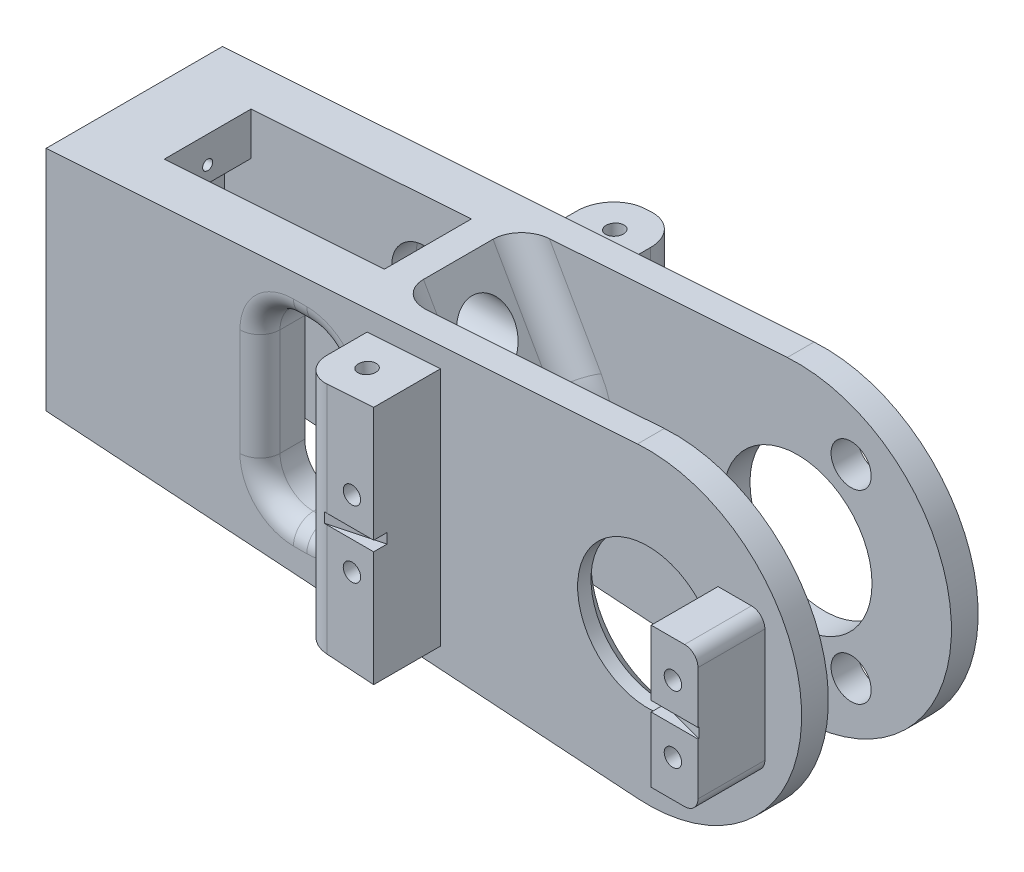
from build123d import *

# Parameters (mm, degrees)
BOSS_EXTRUDE2_DEPTH      = 23.2
BOSS_EXTRUDE2_DEPTH_BACK = 13.2
CUT_EXTRUDE1_DEPTH       = 9.2
CUT_EXTRUDE2_REACH       = 101.77
SKETCH6_R                = 11.125
CUT_EXTRUDE3_REACH       = 97.555
SKETCH7_R                = 10.5
SKETCH8_W                = 41.5
SKETCH8_H                = 21
CUT_EXTRUDE4_DEPTH       = 10
SKETCH9_R                = 1.3
CUT_EXTRUDE5_DEPTH       = 10
CUT_EXTRUDE7_DEPTH       = 0.75
FILLET1_R                = 4
CUT_EXTRUDE8_DEPTH       = 6.5
CUT_EXTRUDE9_REACH       = 119.628
SKETCH13_R               = 0.75
CUT_EXTRUDE10_DEPTH      = 1.5
CUT_EXTRUDE12_REACH      = 97.746
SKETCH20_R               = 4
CUT_EXTRUDE13_START      = -10
SKETCH21_W               = 7
SKETCH21_H               = 21
CUT_EXTRUDE13_DEPTH      = 10
SKETCH22_W               = 12
SKETCH22_H               = 26
CUT_EXTRUDE14_DEPTH      = 97.571013658
FILLET2_R                = 5
FILLET3_R                = 3
BOSS_EXTRUDE3_DEPTH      = 10
SKETCH24_R               = 1.3
CUT_EXTRUDE15_DEPTH      = 102.210689607
FILLET4_R                = 4
FILLET5_R                = 2
FILLET6_R                = 5
CHAMFER1_SIZE            = 2
CUT_EXTRUDE16_REACH      = 101.77
SKETCH25_R               = 3
SKETCH26_R               = 11
CUT_EXTRUDE17_DEPTH      = 2
CUT_EXTRUDE18_DEPTH      = 98.963302489
CUT_EXTRUDE18_DEPTH_BACK = 98.963302489
SKETCH28_R               = 1.3


with BuildPart() as part:
    # Sketch1 → Boss-Extrude2 (new, two sides: drawn at the far end of the back side and taken through both)
    with BuildSketch(Plane.XY.offset(-BOSS_EXTRUDE2_DEPTH_BACK)):
        with BuildLine():
            Line((-90.000003772, 16.999225933), (-1.54332219, 22.94816238))
            ThreePointArc((-1.54332219, 22.94816238), (22.999999999, 0.000154116), (-1.543014653, -22.948183061))
            Line((-1.543014653, -22.948183061), (-90.000003772, -17.000416738))
            Line((-90.000003772, -17.000416738), (-90.000003772, 16.999225933))
        make_face()
    extrude(amount=BOSS_EXTRUDE2_DEPTH + BOSS_EXTRUDE2_DEPTH_BACK)

    # Sketch5 → Cut-Extrude1 (cut, symmetric)
    with BuildSketch(Plane.XY):
        with BuildLine():
            Line((-41.55, 20.257611712), (-1.54332219, 22.94816238))
            ThreePointArc((-1.54332219, 22.94816238), (22.999999999, 0.000154116), (-1.543014653, -22.948183061))
            Line((-1.543014653, -22.948183061), (-41.55, -20.258150283))
            Line((-41.55, -20.258150283), (-32.853088867, -4.93659019))
            ThreePointArc((-32.853088867, -4.93659019), (-31.549690707, 7.5457e-05), (-32.853163366, 4.936721435))
            Line((-32.853163366, 4.936721435), (-41.55, 20.257611712))
        make_face()
    extrude(amount=CUT_EXTRUDE1_DEPTH, both=True, mode=Mode.SUBTRACT)

    # Sketch6 → Cut-Extrude2 (cut, up to next)
    with BuildSketch(Plane(origin=(0, 0, -13.2), x_dir=(-1, 0, 0), z_dir=(0, 0, -1)), mode=Mode.PRIVATE) as cut_extrude2_sk1:
        Circle(SKETCH6_R)
    cut_extrude2_tool1 = extrude(cut_extrude2_sk1.sketch, amount=-CUT_EXTRUDE2_REACH, mode=Mode.PRIVATE) & part.part
    add(cut_extrude2_tool1.solids().sort_by_distance((0, 0, -13.2))[0], mode=Mode.SUBTRACT)

    # Sketch7 → Cut-Extrude3 (cut, up to next)
    with BuildSketch(Plane(origin=(0, 0, 9.2), x_dir=(-1, 0, 0), z_dir=(0, 0, -1)), mode=Mode.PRIVATE) as cut_extrude3_sk1:
        Circle(SKETCH7_R)
    cut_extrude3_tool1 = extrude(cut_extrude3_sk1.sketch, amount=-CUT_EXTRUDE3_REACH, mode=Mode.PRIVATE) & part.part
    add(cut_extrude3_tool1.solids().sort_by_distance((0, 0, 9.2))[0], mode=Mode.SUBTRACT)

    # Sketch8 → Cut-Extrude4 (cut)
    with BuildSketch(Plane.XY.offset(23.2)):
        with Locations((-10.25, 0)):
            Rectangle(SKETCH8_W, SKETCH8_H)
    extrude(amount=-CUT_EXTRUDE4_DEPTH, mode=Mode.SUBTRACT)

    # Sketch9 → Cut-Extrude5 (cut)
    with BuildSketch(Plane.XY.offset(23.2)):
        with Locations((13.75, 5)):
            Circle(SKETCH9_R)
        with Locations((-34.25, 5)):
            Circle(SKETCH9_R)
        with Locations(Location((13.75, -5, 0), (0, 0, 180))):
            Circle(SKETCH9_R)
        with Locations(Location((-34.25, -5, 0), (0, 0, 180))):
            Circle(SKETCH9_R)
    extrude(amount=-CUT_EXTRUDE5_DEPTH, mode=Mode.SUBTRACT)

    # Sketch10 → Cut-Extrude7 (cut, symmetric)
    with BuildSketch(Plane(origin=(0, 0, 0), x_dir=(1, 0, 0), z_dir=(0, 1, 0))):
        Polygon((-31, -23.2), (-38.496594202, -23.2), (-31, -21.2), align=None)
        Polygon((10.5, -23.2), (18, -23.2), (10.5, -21.2), align=None)
    extrude(amount=CUT_EXTRUDE7_DEPTH, both=True, mode=Mode.SUBTRACT)

    # Fillet1
    fillet1_edges = [part.edges().sort_by_distance(p)[0] for p in [
        (-37.201544434, -12.597370237, -9.2),
        (-31.549690707, 7.5457e-05, -9.2),
        (-37.201581683, 12.597166573, -9.2),
        (-37.201581683, 12.597166573, 9.2),
        (-31.549690707, 7.5457e-05, 9.2),
        (-37.201544434, -12.597370237, 9.2),
    ]]
    fillet(fillet1_edges, radius=FILLET1_R)

    # Sketch11 → Cut-Extrude8 (cut, symmetric)
    with BuildSketch(Plane.XY):
        Polygon((-46.099171392, 19.951668384), (-46.09914172, -19.952270192), (-79.024795677, -17.738379603), (-79.024795677, -11.662663454), (-83.024795677, -11.662663454), (-83.024795677, 11.337336546), (-79.024795677, 11.337336546), (-79.024795677, 17.737336546), align=None)
    extrude(amount=CUT_EXTRUDE8_DEPTH, both=True, mode=Mode.SUBTRACT)

    # Sketch12 → Cut-Extrude9 (cut, up to next)
    with BuildSketch(Plane.ZY.offset(90.000003772), mode=Mode.PRIVATE) as cut_extrude9_sk1:
        with BuildLine():
            ThreePointArc((2.892539024, -0.579411765), (0, 2.95), (-2.892539024, -0.579411765))
            ThreePointArc((-2.892539024, -0.579411765), (0, -12.05), (2.892539024, -0.579411765))
        make_face()
    cut_extrude9_tool1 = extrude(cut_extrude9_sk1.sketch, amount=-CUT_EXTRUDE9_REACH, mode=Mode.PRIVATE) & part.part
    add(cut_extrude9_tool1.solids().sort_by_distance((-90.000004, -5.17554, 0))[0], mode=Mode.SUBTRACT)

    # Sketch13 → Cut-Extrude10 (cut)
    with BuildSketch(Plane(origin=(-79.024795677, 0, 0), x_dir=(0, 0, -1), z_dir=(1, 0, 0))):
        with Locations((0, -14.05)):
            Circle(SKETCH13_R)
        with Locations((0, 13.75)):
            Circle(SKETCH13_R)
    extrude(amount=-CUT_EXTRUDE10_DEPTH, mode=Mode.SUBTRACT)

    # Sketch20 → Cut-Extrude12 (cut, up to next)
    with BuildSketch(Plane(origin=(0, 0, 0), x_dir=(0, 0, -1), z_dir=(1, 0, 0)), mode=Mode.PRIVATE) as cut_extrude12_sk1:
        with Locations(Location((0, 12.597166573, 0), (0, 0, 90))):
            Circle(SKETCH20_R)
    cut_extrude12_tool1 = extrude(cut_extrude12_sk1.sketch, amount=-CUT_EXTRUDE12_REACH, mode=Mode.PRIVATE) & part.part
    # Sketch20 → Cut-Extrude12 (cut, up to next)
    with BuildSketch(Plane(origin=(0, 0, 0), x_dir=(0, 0, -1), z_dir=(1, 0, 0)), mode=Mode.PRIVATE) as cut_extrude12_sk2:
        with Locations(Location((0, -12.596982832, 0), (0, 0, 90))):
            Circle(SKETCH20_R)
    cut_extrude12_tool2 = extrude(cut_extrude12_sk2.sketch, amount=-CUT_EXTRUDE12_REACH, mode=Mode.PRIVATE) & part.part
    add(cut_extrude12_tool1.solids().sort_by_distance((0, 12.597167, 0))[0], mode=Mode.SUBTRACT)
    add(cut_extrude12_tool2.solids().sort_by_distance((0, -12.596983, 0))[0], mode=Mode.SUBTRACT)

    # Sketch21 → Cut-Extrude13 (cut)
    with BuildSketch(Plane.XY.offset(23.2).offset(CUT_EXTRUDE13_START)):
        with BuildLine():
            Line((-90.000003772, 16.999225933), (-90.000003772, -17.000416738))
            Line((-90.000003772, -17.000416738), (-1.543014653, -22.948183061))
            ThreePointArc((-1.543014653, -22.948183061), (22.999999999, 0.000154116), (-1.54332219, 22.94816238))
            Line((-1.54332219, 22.94816238), (-90.000003772, 16.999225933))
        make_face()
        Polygon((-31, -17.960748556), (-31, 17.960349298), (-41.975208095, 17.222238686), (-41.975208095, -17.222785691), align=None, mode=Mode.SUBTRACT)
        with Locations((14, 0)):
            Rectangle(SKETCH21_W, SKETCH21_H, mode=Mode.SUBTRACT)
    extrude(amount=CUT_EXTRUDE13_DEPTH, mode=Mode.SUBTRACT)

    # Sketch22 → Cut-Extrude14 (cut, through all)
    with BuildSketch(Plane.XY.offset(13.2)):
        with Locations((-52, 0)):
            Rectangle(SKETCH22_W, SKETCH22_H)
    extrude(amount=-CUT_EXTRUDE14_DEPTH, mode=Mode.SUBTRACT)

    # Fillet2
    # the kernel refuses this fillet: 5 mm, written as the material it adds along each edge
    with BuildSketch(Plane(origin=(-58, -13, -6.5), x_dir=(1, 0, 0), z_dir=(0, 0, -1)), Plane(origin=(-58, 13, -6.5), x_dir=(0, -1, 0), z_dir=(0, 0, -1)), Plane(origin=(-58, -13, 13.2), x_dir=(1, 0, 0), z_dir=(0, 0, -1))) as fillet2_piece_1:
        with BuildLine():
            CenterArc((FILLET2_R, -FILLET2_R), FILLET2_R, 90, 90)
            Line((0, -FILLET2_R), (0, 0))
            Line((0, 0), (FILLET2_R, 0))
        make_face()
    extrude(amount=6.7)
    with BuildSketch(Plane(origin=(-46, -13, 8.520354644), x_dir=(-1, 0, 0), z_dir=(0, 0, -1))) as fillet2_piece_2_section:
        with BuildLine():
            CenterArc((FILLET2_R, FILLET2_R), FILLET2_R, 180, 90)
            Line((0, FILLET2_R), (0, 0))
            Line((0, 0), (FILLET2_R, 0))
        make_face()
    fillet2_piece_2 = extrude(amount=21.720354644, mode=Mode.PRIVATE)
    fillet2_piece_2 = split(fillet2_piece_2, bisect_by=Plane(origin=(-47.331007708, -12.072495105, 6.5), z_dir=(0, 0, 1)), keep=Keep.TOP, mode=Mode.PRIVATE)
    fillet2_piece_2 = split(fillet2_piece_2, bisect_by=Plane(origin=(-46.09914758, -12.072494189, 7.510177322), z_dir=(-0.9999999999997237, -7.435896198998702e-07, 0)), keep=Keep.TOP, mode=Mode.PRIVATE)
    add(fillet2_piece_2)
    with BuildSketch(Plane(origin=(-46, -13, 8.520354644), x_dir=(-1, 0, 0), z_dir=(0, 0, -1))) as fillet2_piece_3_section:
        with BuildLine():
            CenterArc((FILLET2_R, FILLET2_R), FILLET2_R, 180, 90)
            Line((0, FILLET2_R), (0, 0))
            Line((0, 0), (FILLET2_R, 0))
        make_face()
    fillet2_piece_3 = extrude(amount=21.720354644, mode=Mode.PRIVATE)
    fillet2_piece_3 = split(fillet2_piece_3, bisect_by=Plane(origin=(-45.995438086, -10.700431133, 6.5), z_dir=(0, 0, 1)), keep=Keep.TOP, mode=Mode.PRIVATE)
    fillet2_piece_3 = split(fillet2_piece_3, bisect_by=Plane(origin=(-46.0991486, -10.70043121, 7.510177322), z_dir=(0.9999999999997237, 7.435896198998702e-07, 0)), keep=Keep.TOP, mode=Mode.PRIVATE)
    add(fillet2_piece_3)
    with BuildSketch(Plane(origin=(-46, -13, 8.520354644), x_dir=(-1, 0, 0), z_dir=(0, 0, -1))) as fillet2_piece_4_section:
        with BuildLine():
            CenterArc((FILLET2_R, FILLET2_R), FILLET2_R, 180, 90)
            Line((0, FILLET2_R), (0, 0))
            Line((0, 0), (FILLET2_R, 0))
        make_face()
    fillet2_piece_4 = extrude(amount=21.720354644, mode=Mode.PRIVATE)
    fillet2_piece_4 = split(fillet2_piece_4, bisect_by=Plane(origin=(-46.006211132, -8.49973528, 6.5), z_dir=(0, 0, -1)), keep=Keep.TOP, mode=Mode.PRIVATE)
    fillet2_piece_4 = split(fillet2_piece_4, bisect_by=Plane(origin=(-46.099150236, -8.499735349, 0), z_dir=(0.9999999999997237, 7.435896198998702e-07, 0)), keep=Keep.TOP, mode=Mode.PRIVATE)
    fillet2_piece_4 = split(fillet2_piece_4, bisect_by=Plane(origin=(-46.006211132, -8.49973528, -6.5), z_dir=(0, 0, 1)), keep=Keep.TOP, mode=Mode.PRIVATE)
    fillet2_piece_4 = fillet2_piece_4 - Plane(origin=(-46.006211132, -12.596982832, 0), x_dir=(0, 1, 0), z_dir=(1, 0, 0)) * Cylinder(4, 64, mode=Mode.PRIVATE)
    add(fillet2_piece_4)
    with BuildSketch(Plane(origin=(-46, -13, 8.520354644), x_dir=(-1, 0, 0), z_dir=(0, 0, -1))) as fillet2_piece_5_section:
        with BuildLine():
            CenterArc((FILLET2_R, FILLET2_R), FILLET2_R, 180, 90)
            Line((0, FILLET2_R), (0, 0))
            Line((0, 0), (FILLET2_R, 0))
        make_face()
    fillet2_piece_5 = extrude(amount=21.720354644, mode=Mode.PRIVATE)
    fillet2_piece_5 = split(fillet2_piece_5, bisect_by=Plane(origin=(-46.0991486, -10.70043121, -9.85), z_dir=(0.9999999999997237, 7.435896198998702e-07, 0)), keep=Keep.TOP, mode=Mode.PRIVATE)
    fillet2_piece_5 = split(fillet2_piece_5, bisect_by=Plane(origin=(-45.995438086, -10.700431133, -6.5), z_dir=(0, 0, -1)), keep=Keep.TOP, mode=Mode.PRIVATE)
    add(fillet2_piece_5)
    with BuildSketch(Plane(origin=(-46, -13, 8.520354644), x_dir=(-1, 0, 0), z_dir=(0, 0, -1))) as fillet2_piece_6_section:
        with BuildLine():
            CenterArc((FILLET2_R, FILLET2_R), FILLET2_R, 180, 90)
            Line((0, FILLET2_R), (0, 0))
            Line((0, 0), (FILLET2_R, 0))
        make_face()
    fillet2_piece_6 = extrude(amount=21.720354644, mode=Mode.PRIVATE)
    fillet2_piece_6 = split(fillet2_piece_6, bisect_by=Plane(origin=(-46.09914758, -12.072494189, -9.85), z_dir=(-0.9999999999997237, -7.435896198998702e-07, 0)), keep=Keep.TOP, mode=Mode.PRIVATE)
    fillet2_piece_6 = split(fillet2_piece_6, bisect_by=Plane(origin=(-47.331007708, -12.072495105, -6.5), z_dir=(0, 0, -1)), keep=Keep.TOP, mode=Mode.PRIVATE)
    add(fillet2_piece_6)
    with BuildSketch(Plane(origin=(-46, -13, 13.2), x_dir=(0, 1, 0), z_dir=(0, 0, -1))) as fillet2_piece_7_section:
        with BuildLine():
            CenterArc((FILLET2_R, -FILLET2_R), FILLET2_R, 90, 90)
            Line((0, -FILLET2_R), (0, 0))
            Line((0, 0), (FILLET2_R, 0))
        make_face()
    fillet2_piece_7 = extrude(amount=21.720354644, mode=Mode.PRIVATE)
    fillet2_piece_7 = split(fillet2_piece_7, bisect_by=Plane(origin=(-45.995438086, -10.700431133, 6.5), z_dir=(0, 0, 1)), keep=Keep.TOP, mode=Mode.PRIVATE)
    fillet2_piece_7 = split(fillet2_piece_7, bisect_by=Plane(origin=(-46.0991486, -10.70043121, 9.85), z_dir=(0.9999999999997237, 7.435896198998702e-07, 0)), keep=Keep.TOP, mode=Mode.PRIVATE)
    add(fillet2_piece_7)
    with BuildSketch(Plane(origin=(-46, -13, 13.2), x_dir=(0, 1, 0), z_dir=(0, 0, -1))) as fillet2_piece_8_section:
        with BuildLine():
            CenterArc((FILLET2_R, -FILLET2_R), FILLET2_R, 90, 90)
            Line((0, -FILLET2_R), (0, 0))
            Line((0, 0), (FILLET2_R, 0))
        make_face()
    fillet2_piece_8 = extrude(amount=21.720354644, mode=Mode.PRIVATE)
    fillet2_piece_8 = split(fillet2_piece_8, bisect_by=Plane(origin=(-47.331007708, -12.072495105, 6.5), z_dir=(0, 0, 1)), keep=Keep.TOP, mode=Mode.PRIVATE)
    fillet2_piece_8 = split(fillet2_piece_8, bisect_by=Plane(origin=(-46.09914758, -12.072494189, 9.85), z_dir=(-0.9999999999997237, -7.435896198998702e-07, 0)), keep=Keep.TOP, mode=Mode.PRIVATE)
    add(fillet2_piece_8)
    with BuildSketch(Plane(origin=(-46, -13, 13.2), x_dir=(0, 1, 0), z_dir=(0, 0, -1))) as fillet2_piece_9_section:
        with BuildLine():
            CenterArc((FILLET2_R, -FILLET2_R), FILLET2_R, 90, 90)
            Line((0, -FILLET2_R), (0, 0))
            Line((0, 0), (FILLET2_R, 0))
        make_face()
    fillet2_piece_9 = extrude(amount=21.720354644, mode=Mode.PRIVATE)
    fillet2_piece_9 = split(fillet2_piece_9, bisect_by=Plane(origin=(-46.006211132, -8.49973528, 6.5), z_dir=(0, 0, -1)), keep=Keep.TOP, mode=Mode.PRIVATE)
    fillet2_piece_9 = split(fillet2_piece_9, bisect_by=Plane(origin=(-46.099150236, -8.499735349, 0), z_dir=(0.9999999999997237, 7.435896198998702e-07, 0)), keep=Keep.TOP, mode=Mode.PRIVATE)
    fillet2_piece_9 = split(fillet2_piece_9, bisect_by=Plane(origin=(-46.006211132, -8.49973528, -6.5), z_dir=(0, 0, 1)), keep=Keep.TOP, mode=Mode.PRIVATE)
    fillet2_piece_9 = fillet2_piece_9 - Plane(origin=(-46.006211132, -12.596982832, 0), x_dir=(0, 1, 0), z_dir=(1, 0, 0)) * Cylinder(4, 64, mode=Mode.PRIVATE)
    add(fillet2_piece_9)
    with BuildSketch(Plane(origin=(-46, -13, 13.2), x_dir=(0, 1, 0), z_dir=(0, 0, -1))) as fillet2_piece_10_section:
        with BuildLine():
            CenterArc((FILLET2_R, -FILLET2_R), FILLET2_R, 90, 90)
            Line((0, -FILLET2_R), (0, 0))
            Line((0, 0), (FILLET2_R, 0))
        make_face()
    fillet2_piece_10 = extrude(amount=21.720354644, mode=Mode.PRIVATE)
    fillet2_piece_10 = split(fillet2_piece_10, bisect_by=Plane(origin=(-46.0991486, -10.70043121, -7.510177322), z_dir=(0.9999999999997237, 7.435896198998702e-07, 0)), keep=Keep.TOP, mode=Mode.PRIVATE)
    fillet2_piece_10 = split(fillet2_piece_10, bisect_by=Plane(origin=(-45.995438086, -10.700431133, -6.5), z_dir=(0, 0, -1)), keep=Keep.TOP, mode=Mode.PRIVATE)
    add(fillet2_piece_10)
    with BuildSketch(Plane(origin=(-46, -13, 13.2), x_dir=(0, 1, 0), z_dir=(0, 0, -1))) as fillet2_piece_11_section:
        with BuildLine():
            CenterArc((FILLET2_R, -FILLET2_R), FILLET2_R, 90, 90)
            Line((0, -FILLET2_R), (0, 0))
            Line((0, 0), (FILLET2_R, 0))
        make_face()
    fillet2_piece_11 = extrude(amount=21.720354644, mode=Mode.PRIVATE)
    fillet2_piece_11 = split(fillet2_piece_11, bisect_by=Plane(origin=(-46.09914758, -12.072494189, -7.510177322), z_dir=(-0.9999999999997237, -7.435896198998702e-07, 0)), keep=Keep.TOP, mode=Mode.PRIVATE)
    fillet2_piece_11 = split(fillet2_piece_11, bisect_by=Plane(origin=(-47.331007708, -12.072495105, -6.5), z_dir=(0, 0, -1)), keep=Keep.TOP, mode=Mode.PRIVATE)
    add(fillet2_piece_11)
    with BuildSketch(Plane(origin=(-58, 13, 13.2), x_dir=(1, 0, 0), z_dir=(0, 0, -1))) as fillet2_piece_12:
        with BuildLine():
            CenterArc((FILLET2_R, FILLET2_R), FILLET2_R, 180, 90)
            Line((0, FILLET2_R), (0, 0))
            Line((0, 0), (FILLET2_R, 0))
        make_face()
    extrude(amount=6.7)
    with BuildSketch(Plane(origin=(-46, 13, 8.520336041), x_dir=(-1, 0, 0), z_dir=(0, 0, -1))) as fillet2_piece_13_section:
        with BuildLine():
            CenterArc((FILLET2_R, -FILLET2_R), FILLET2_R, 90, 90)
            Line((0, -FILLET2_R), (0, 0))
            Line((0, 0), (FILLET2_R, 0))
        make_face()
    fillet2_piece_13 = extrude(amount=21.720336041, mode=Mode.PRIVATE)
    fillet2_piece_13 = split(fillet2_piece_13, bisect_by=Plane(origin=(-47.331023035, 12.0725063, 6.5), z_dir=(0, 0, 1)), keep=Keep.TOP, mode=Mode.PRIVATE)
    fillet2_piece_13 = split(fillet2_piece_13, bisect_by=Plane(origin=(-46.099165534, 12.072507216, 7.51016802), z_dir=(-0.9999999999997237, -7.435896198998702e-07, 0)), keep=Keep.TOP, mode=Mode.PRIVATE)
    add(fillet2_piece_13)
    with BuildSketch(Plane(origin=(-46, 13, 8.520336041), x_dir=(-1, 0, 0), z_dir=(0, 0, -1))) as fillet2_piece_14_section:
        with BuildLine():
            CenterArc((FILLET2_R, -FILLET2_R), FILLET2_R, 90, 90)
            Line((0, -FILLET2_R), (0, 0))
            Line((0, 0), (FILLET2_R, 0))
        make_face()
    fillet2_piece_14 = extrude(amount=21.720336041, mode=Mode.PRIVATE)
    fillet2_piece_14 = split(fillet2_piece_14, bisect_by=Plane(origin=(-45.995445455, 10.700464693, 6.5), z_dir=(0, 0, 1)), keep=Keep.TOP, mode=Mode.PRIVATE)
    fillet2_piece_14 = split(fillet2_piece_14, bisect_by=Plane(origin=(-46.099164513, 10.700464615, 7.51016802), z_dir=(0.9999999999997237, 7.435896198998702e-07, 0)), keep=Keep.TOP, mode=Mode.PRIVATE)
    add(fillet2_piece_14)
    with BuildSketch(Plane(origin=(-46, 13, 8.520336041), x_dir=(-1, 0, 0), z_dir=(0, 0, -1))) as fillet2_piece_15_section:
        with BuildLine():
            CenterArc((FILLET2_R, -FILLET2_R), FILLET2_R, 90, 90)
            Line((0, -FILLET2_R), (0, 0))
            Line((0, 0), (FILLET2_R, 0))
        make_face()
    fillet2_piece_15 = extrude(amount=21.720336041, mode=Mode.PRIVATE)
    fillet2_piece_15 = split(fillet2_piece_15, bisect_by=Plane(origin=(-46.006213875, 8.499769048, 6.5), z_dir=(0, 0, -1)), keep=Keep.TOP, mode=Mode.PRIVATE)
    fillet2_piece_15 = split(fillet2_piece_15, bisect_by=Plane(origin=(-46.006213875, 8.499769048, -6.5), z_dir=(0, 0, 1)), keep=Keep.TOP, mode=Mode.PRIVATE)
    fillet2_piece_15 = fillet2_piece_15 - Plane(origin=(-46.006213875, 12.597166573, 0), x_dir=(0, 1, 0), z_dir=(1, 0, 0)) * Cylinder(4, 64, mode=Mode.PRIVATE)
    fillet2_piece_15 = split(fillet2_piece_15, bisect_by=Plane(origin=(-46.099162877, 8.499768979, 0), z_dir=(0.9999999999997237, 7.435896198998702e-07, 0)), keep=Keep.TOP, mode=Mode.PRIVATE)
    add(fillet2_piece_15)
    with BuildSketch(Plane(origin=(-46, 13, 8.520336041), x_dir=(-1, 0, 0), z_dir=(0, 0, -1))) as fillet2_piece_16_section:
        with BuildLine():
            CenterArc((FILLET2_R, -FILLET2_R), FILLET2_R, 90, 90)
            Line((0, -FILLET2_R), (0, 0))
            Line((0, 0), (FILLET2_R, 0))
        make_face()
    fillet2_piece_16 = extrude(amount=21.720336041, mode=Mode.PRIVATE)
    fillet2_piece_16 = split(fillet2_piece_16, bisect_by=Plane(origin=(-45.995445455, 10.700464693, -6.5), z_dir=(0, 0, -1)), keep=Keep.TOP, mode=Mode.PRIVATE)
    fillet2_piece_16 = split(fillet2_piece_16, bisect_by=Plane(origin=(-46.099164513, 10.700464615, -9.85), z_dir=(0.9999999999997237, 7.435896198998702e-07, 0)), keep=Keep.TOP, mode=Mode.PRIVATE)
    add(fillet2_piece_16)
    with BuildSketch(Plane(origin=(-46, 13, 8.520336041), x_dir=(-1, 0, 0), z_dir=(0, 0, -1))) as fillet2_piece_17_section:
        with BuildLine():
            CenterArc((FILLET2_R, -FILLET2_R), FILLET2_R, 90, 90)
            Line((0, -FILLET2_R), (0, 0))
            Line((0, 0), (FILLET2_R, 0))
        make_face()
    fillet2_piece_17 = extrude(amount=21.720336041, mode=Mode.PRIVATE)
    fillet2_piece_17 = split(fillet2_piece_17, bisect_by=Plane(origin=(-47.331023035, 12.0725063, -6.5), z_dir=(0, 0, -1)), keep=Keep.TOP, mode=Mode.PRIVATE)
    fillet2_piece_17 = split(fillet2_piece_17, bisect_by=Plane(origin=(-46.099165534, 12.072507216, -9.85), z_dir=(-0.9999999999997237, -7.435896198998702e-07, 0)), keep=Keep.TOP, mode=Mode.PRIVATE)
    add(fillet2_piece_17)
    with BuildSketch(Plane(origin=(-46, 13, 13.2), x_dir=(0, -1, 0), z_dir=(0, 0, -1))) as fillet2_piece_18_section:
        with BuildLine():
            CenterArc((FILLET2_R, FILLET2_R), FILLET2_R, 180, 90)
            Line((0, FILLET2_R), (0, 0))
            Line((0, 0), (FILLET2_R, 0))
        make_face()
    fillet2_piece_18 = extrude(amount=21.720336041, mode=Mode.PRIVATE)
    fillet2_piece_18 = split(fillet2_piece_18, bisect_by=Plane(origin=(-45.995445455, 10.700464693, 6.5), z_dir=(0, 0, 1)), keep=Keep.TOP, mode=Mode.PRIVATE)
    fillet2_piece_18 = split(fillet2_piece_18, bisect_by=Plane(origin=(-46.099164513, 10.700464615, 9.85), z_dir=(0.9999999999997237, 7.435896198998702e-07, 0)), keep=Keep.TOP, mode=Mode.PRIVATE)
    add(fillet2_piece_18)
    with BuildSketch(Plane(origin=(-46, 13, 13.2), x_dir=(0, -1, 0), z_dir=(0, 0, -1))) as fillet2_piece_19_section:
        with BuildLine():
            CenterArc((FILLET2_R, FILLET2_R), FILLET2_R, 180, 90)
            Line((0, FILLET2_R), (0, 0))
            Line((0, 0), (FILLET2_R, 0))
        make_face()
    fillet2_piece_19 = extrude(amount=21.720336041, mode=Mode.PRIVATE)
    fillet2_piece_19 = split(fillet2_piece_19, bisect_by=Plane(origin=(-47.331023035, 12.0725063, 6.5), z_dir=(0, 0, 1)), keep=Keep.TOP, mode=Mode.PRIVATE)
    fillet2_piece_19 = split(fillet2_piece_19, bisect_by=Plane(origin=(-46.099165534, 12.072507216, 9.85), z_dir=(-0.9999999999997237, -7.435896198998702e-07, 0)), keep=Keep.TOP, mode=Mode.PRIVATE)
    add(fillet2_piece_19)
    with BuildSketch(Plane(origin=(-46, 13, 13.2), x_dir=(0, -1, 0), z_dir=(0, 0, -1))) as fillet2_piece_20_section:
        with BuildLine():
            CenterArc((FILLET2_R, FILLET2_R), FILLET2_R, 180, 90)
            Line((0, FILLET2_R), (0, 0))
            Line((0, 0), (FILLET2_R, 0))
        make_face()
    fillet2_piece_20 = extrude(amount=21.720336041, mode=Mode.PRIVATE)
    fillet2_piece_20 = split(fillet2_piece_20, bisect_by=Plane(origin=(-46.00621387, 8.499769041, 6.5), z_dir=(0, 0, -1)), keep=Keep.TOP, mode=Mode.PRIVATE)
    fillet2_piece_20 = split(fillet2_piece_20, bisect_by=Plane(origin=(-46.00621387, 8.499769041, -6.5), z_dir=(0, 0, 1)), keep=Keep.TOP, mode=Mode.PRIVATE)
    fillet2_piece_20 = fillet2_piece_20 - Plane(origin=(-46.00621387, 12.597166573, 0), x_dir=(0, 1, 0), z_dir=(1, 0, 0)) * Cylinder(4, 64, mode=Mode.PRIVATE)
    fillet2_piece_20 = split(fillet2_piece_20, bisect_by=Plane(origin=(-46.099162877, 8.499768972, 0), z_dir=(0.9999999999997237, 7.435896198998702e-07, 0)), keep=Keep.TOP, mode=Mode.PRIVATE)
    add(fillet2_piece_20)
    with BuildSketch(Plane(origin=(-46, 13, 13.2), x_dir=(0, -1, 0), z_dir=(0, 0, -1))) as fillet2_piece_21_section:
        with BuildLine():
            CenterArc((FILLET2_R, FILLET2_R), FILLET2_R, 180, 90)
            Line((0, FILLET2_R), (0, 0))
            Line((0, 0), (FILLET2_R, 0))
        make_face()
    fillet2_piece_21 = extrude(amount=21.720336041, mode=Mode.PRIVATE)
    fillet2_piece_21 = split(fillet2_piece_21, bisect_by=Plane(origin=(-45.995445455, 10.700464693, -6.5), z_dir=(0, 0, -1)), keep=Keep.TOP, mode=Mode.PRIVATE)
    fillet2_piece_21 = split(fillet2_piece_21, bisect_by=Plane(origin=(-46.099164513, 10.700464615, -7.51016802), z_dir=(0.9999999999997237, 7.435896198998702e-07, 0)), keep=Keep.TOP, mode=Mode.PRIVATE)
    add(fillet2_piece_21)
    with BuildSketch(Plane(origin=(-46, 13, 13.2), x_dir=(0, -1, 0), z_dir=(0, 0, -1))) as fillet2_piece_22_section:
        with BuildLine():
            CenterArc((FILLET2_R, FILLET2_R), FILLET2_R, 180, 90)
            Line((0, FILLET2_R), (0, 0))
            Line((0, 0), (FILLET2_R, 0))
        make_face()
    fillet2_piece_22 = extrude(amount=21.720336041, mode=Mode.PRIVATE)
    fillet2_piece_22 = split(fillet2_piece_22, bisect_by=Plane(origin=(-47.331023035, 12.0725063, -6.5), z_dir=(0, 0, -1)), keep=Keep.TOP, mode=Mode.PRIVATE)
    fillet2_piece_22 = split(fillet2_piece_22, bisect_by=Plane(origin=(-46.099165534, 12.072507216, -7.51016802), z_dir=(-0.9999999999997237, -7.435896198998702e-07, 0)), keep=Keep.TOP, mode=Mode.PRIVATE)
    add(fillet2_piece_22)

    # Fillet3
    fillet3_edges = [part.edges().sort_by_distance(p)[0] for p in [
        (-52, -13, -13.2),
        (-58, 0, -13.2),
        (-46, 0, -13.2),
        (-46, 0, 13.2),
        (-52, 13, -13.2),
        (-52, -13, 13.2),
        (-58, 0, 13.2),
        (-52, 13, 13.2),
        (-56.535533906, -11.535533906, -13.2),
        (-47.464466094, -11.535533906, -13.2),
        (-56.535533906, 11.535533906, -13.2),
        (-47.834110609, 11.870031572, -13.2),
        (-56.535533906, -11.535533906, 13.2),
        (-47.464466094, -11.535533906, 13.2),
        (-56.535533906, 11.535533906, 13.2),
        (-47.834110609, 11.870031572, 13.2),
    ]]
    fillet(fillet3_edges, radius=FILLET3_R)

    # Sketch23 → Boss-Extrude3 (add)
    with BuildSketch(Plane(origin=(0, 0, -13.2), x_dir=(-1, 0, 0), z_dir=(0, 0, -1))):
        Polygon((41.975208095, 7.960349298), (41.975208095, 17.222238686), (31, 17.960349298), (31, 7.960349298), align=None)
        Polygon((31, -17.960748556), (31, -7.960748556), (41.975208095, -7.960748556), (41.975208095, -17.222785691), align=None)
    extrude(amount=BOSS_EXTRUDE3_DEPTH)

    # Sketch24 → Cut-Extrude15 (cut, through all)
    with BuildSketch(Plane(origin=(-1.342019296, 19.954923809, 0), x_dir=(0.9977461904329615, 0.06710096479569118, 0), z_dir=(-0.06710096479569116, 0.9977461904329614, 0))):
        with Locations(Location((-35.724975137, -18.2, 0), (0, 0, 180))):
            Circle(SKETCH24_R)
    extrude(amount=-CUT_EXTRUDE15_DEPTH, mode=Mode.SUBTRACT)

    # Fillet4
    # the kernel refuses this fillet: 4 mm, written as the material it takes off along each edge
    with BuildSketch(Plane(origin=(-41.975208095, 27.222238686, 23.2), x_dir=(0, 0, -1), z_dir=(0, -1, 0))) as fillet4_piece_1:
        with BuildLine():
            CenterArc((FILLET4_R, FILLET4_R), FILLET4_R, 180, 90)
            Line((0, FILLET4_R), (0, 0))
            Line((0, 0), (FILLET4_R, 0))
        make_face()
    extrude(amount=54.445024376, mode=Mode.SUBTRACT)

    # Fillet5
    fillet5_edges = [part.edges().sort_by_distance(p)[0] for p in [
        (17.5, -10.5, 18.2),
        (17.5, 10.5, 18.2),
    ]]
    fillet(fillet5_edges, radius=FILLET5_R)

    # Fillet6
    fillet6_edges = [part.edges().sort_by_distance(p)[0] for p in [
        (-41.975208095, 12.591293992, -23.2),
        (-31, 12.960349298, -23.2),
        (-31, -12.960748556, -23.2),
        (-41.975208095, -12.591767123, -23.2),
    ]]
    fillet(fillet6_edges, radius=FILLET6_R)

    # Chamfer1
    chamfer1_edges = [part.edges().sort_by_distance(p)[0] for p in [
        (10.5, 0, 9.2),
    ]]
    chamfer(chamfer1_edges, length=CHAMFER1_SIZE)

    # Sketch25 → Cut-Extrude16 (cut, up to next)
    with BuildSketch(Plane(origin=(0, 0, -13.2), x_dir=(-1, 0, 0), z_dir=(0, 0, -1)), mode=Mode.PRIVATE) as cut_extrude16_sk1:
        with Locations((-8, 13.856406461)):
            Circle(SKETCH25_R)
    cut_extrude16_tool1 = extrude(cut_extrude16_sk1.sketch, amount=-CUT_EXTRUDE16_REACH, mode=Mode.PRIVATE) & part.part
    # Sketch25 → Cut-Extrude16 (cut, up to next)
    with BuildSketch(Plane(origin=(0, 0, -13.2), x_dir=(-1, 0, 0), z_dir=(0, 0, -1)), mode=Mode.PRIVATE) as cut_extrude16_sk2:
        with Locations((-8, -13.856406461)):
            Circle(SKETCH25_R)
    cut_extrude16_tool2 = extrude(cut_extrude16_sk2.sketch, amount=-CUT_EXTRUDE16_REACH, mode=Mode.PRIVATE) & part.part
    add(cut_extrude16_tool1.solids().sort_by_distance((8, 13.856406, -13.2))[0], mode=Mode.SUBTRACT)
    add(cut_extrude16_tool2.solids().sort_by_distance((8, -13.856406, -13.2))[0], mode=Mode.SUBTRACT)

    # Sketch26 → Cut-Extrude17 (cut)
    with BuildSketch(Plane.ZY.offset(90.000003772)):
        with Locations((0, -5.95)):
            Circle(SKETCH26_R)
    extrude(amount=-CUT_EXTRUDE17_DEPTH, mode=Mode.SUBTRACT)

    # Sketch28 → Cut-Extrude18 (cut, two sides: drawn at the far end of the back side and taken through both)
    with BuildSketch(Plane(origin=(0, -7.960748556, 0), x_dir=(1, 0, 0), z_dir=(0, 1, 0)).offset(-CUT_EXTRUDE18_DEPTH_BACK)):
        with Locations(Location((-36.341054863, 18.2, 0), (0, 0, 270))):
            Circle(SKETCH28_R)
    extrude(amount=CUT_EXTRUDE18_DEPTH + CUT_EXTRUDE18_DEPTH_BACK, mode=Mode.SUBTRACT)


solid = part.part
